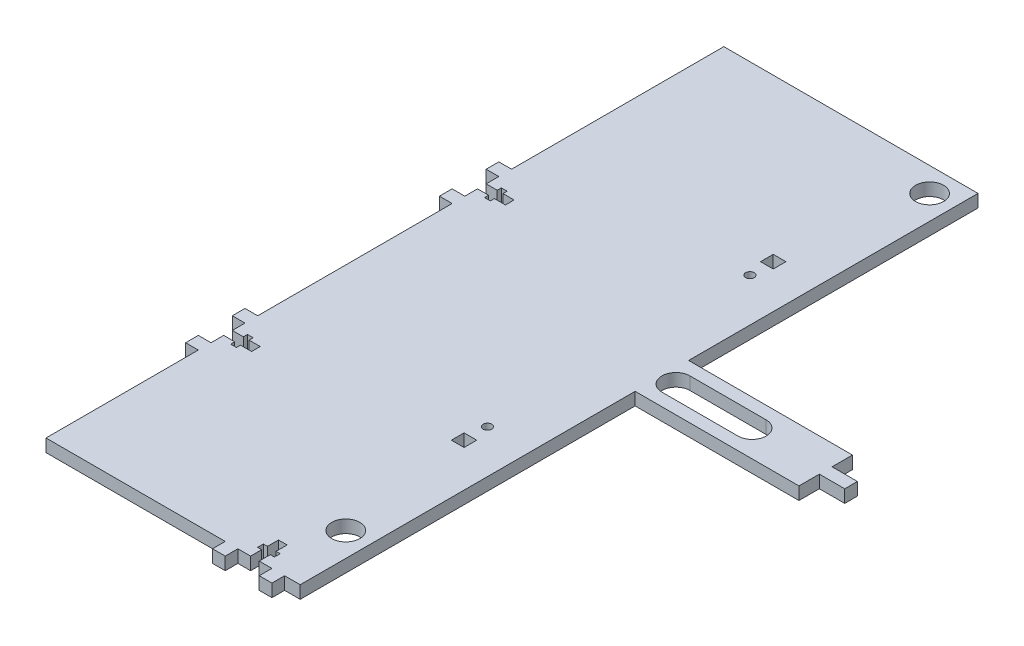
from build123d import *

# Parameters (mm, degrees)
AXLE_SUPPORT_PLATE_W   = 6.35
AXLE_SUPPORT_PLATE_H   = 6.35
AXLE_SUPPORT_PLATE_R   = 2.159
AXLE_SUPPORT_PLATE_R_2 = 7.030128061
BOSS_EXTRUDE1_DEPTH    = 6.35


with BuildPart() as part:
    # Axle Support Plate → Boss-Extrude1 (new body)
    with BuildSketch(Plane(origin=(0, 0, 0), x_dir=(1, 0, 0), z_dir=(0, 1, 0))):
        Polygon((29.718, -180.975), (37.510128061, -180.975), (37.510128061, -13.380128061), (119.470256121, -13.380128061), (119.470256121, -3.175), (132.170256121, -3.175), (132.170256121, 3.175), (119.470256121, 3.175), (119.470256121, 13.380128061), (37.510128061, 13.380128061), (37.510128061, 158.160128061), (-89.662, 158.160128061), (-89.662, 51.943), (-96.012, 51.943), (-96.012, 45.593), (-89.662, 45.593), (-89.662, 39.243), (-84.127000021, 39.243), (-84.127000021, 41.283999982), (-81.226999979, 41.283999982), (-81.226999979, 39.243), (-75.692, 39.243), (-75.692, 34.925), (-81.226999979, 34.925), (-81.226999979, 32.884000018), (-84.127000021, 32.884000018), (-84.127000021, 34.925), (-89.662, 34.925), (-89.662, 28.575), (-96.012, 28.575), (-96.012, 22.225), (-89.662, 22.225), (-89.662, -75.057), (-96.012, -75.057), (-96.012, -81.407), (-89.662, -81.407), (-89.662, -87.757), (-84.127000021, -87.757), (-84.127000021, -85.716000018), (-81.226999979, -85.716000018), (-81.226999979, -87.757), (-75.692, -87.757), (-75.692, -92.075), (-81.226999979, -92.075), (-81.226999979, -94.115999982), (-84.127000021, -94.115999982), (-84.127000021, -92.075), (-89.662, -92.075), (-89.662, -98.425), (-96.012, -98.425), (-96.012, -104.775), (-89.662, -104.775), (-89.662, -180.975), (0, -180.975), (0, -187.325), (6.35, -187.325), (6.35, -180.975), (12.7, -180.975), (12.7, -175.440000021), (10.659000018, -175.440000021), (10.659000018, -172.539999979), (12.7, -172.539999979), (12.7, -167.005), (17.018, -167.005), (17.018, -172.539999979), (19.058999982, -172.539999979), (19.058999982, -175.440000021), (17.018, -175.440000021), (17.018, -180.975), (23.368, -180.975), (23.368, -187.325), (29.718, -187.325), align=None)
        with Locations((15.875, -77.343)):
            Rectangle(AXLE_SUPPORT_PLATE_W, AXLE_SUPPORT_PLATE_H, mode=Mode.SUBTRACT)
        with Locations((15.875, -65.659)):
            Circle(AXLE_SUPPORT_PLATE_R, mode=Mode.SUBTRACT)
        with Locations((25.4, -146.05)):
            Circle(AXLE_SUPPORT_PLATE_R_2, mode=Mode.SUBTRACT)
        with Locations((15.875, 65.659)):
            Circle(AXLE_SUPPORT_PLATE_R, mode=Mode.SUBTRACT)
        with Locations((15.875, 77.343)):
            Rectangle(AXLE_SUPPORT_PLATE_W, AXLE_SUPPORT_PLATE_H, mode=Mode.SUBTRACT)
        with BuildLine():
            ThreePointArc((44.540256121, -7.030128061), (37.510128061, 0), (44.540256121, 7.030128061))
            Line((44.540256121, 7.030128061), (82.640256121, 7.030128061))
            ThreePointArc((82.640256121, 7.030128061), (89.670384182, 0), (82.640256121, -7.030128061))
            Line((82.640256121, -7.030128061), (44.540256121, -7.030128061))
        make_face(mode=Mode.SUBTRACT)
        with Locations((25.4, 146.05)):
            Circle(AXLE_SUPPORT_PLATE_R_2, mode=Mode.SUBTRACT)
    extrude(amount=BOSS_EXTRUDE1_DEPTH)


solid = part.part
